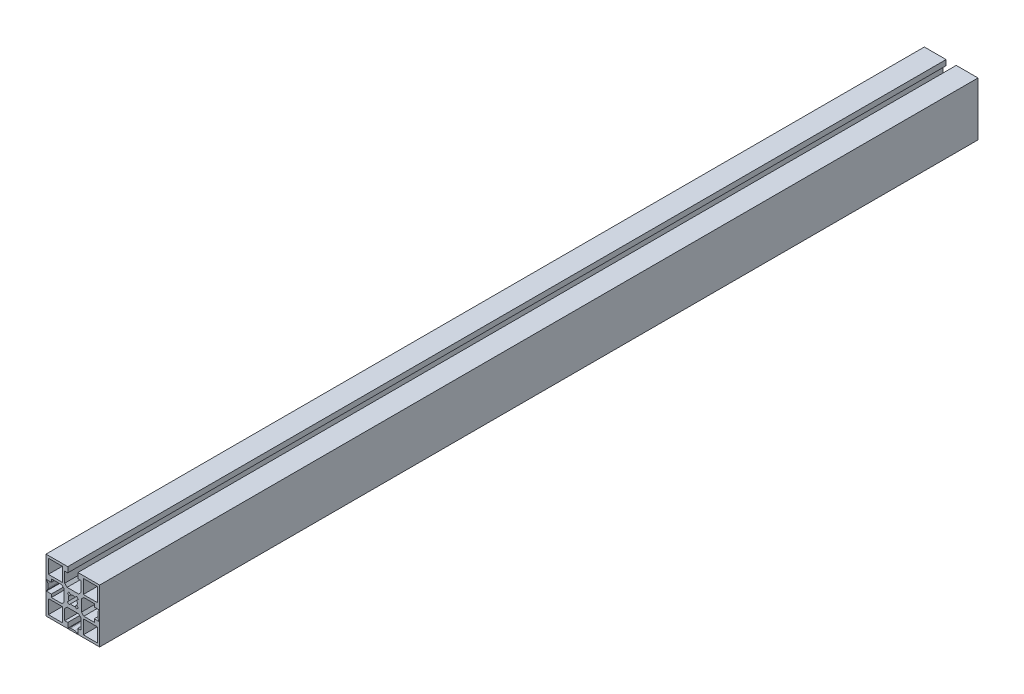
from build123d import *

# Parameters (mm, degrees)
SKETCH1_W           = 11.699975178
SKETCH1_H           = 11.699996949
SKETCH1_W_2         = 11.699990436
SKETCH1_H_2         = 11.699981689
SKETCH1_W_3         = 11.699990437
SKETCH1_H_3         = 11.699975177
SKETCH1_W_4         = 11.699981689
SKETCH1_H_4         = 11.699990436
BOSS_EXTRUDE1_DEPTH = 736.6


with BuildPart() as part:
    # Sketch1 → Boss-Extrude1 (new body)
    with BuildSketch(Plane.XY):
        Polygon((-4.249491247, 17.999291576), (-4.249490956, 22.199304807), (-4.249490956, 22.499297883), (-22.499484399, 22.499298105), (-22.499484948, -22.500701346), (22.500514502, -22.500701895), (22.500515052, 22.499297556), (4.250509108, 22.499297779), (4.250509108, 22.199304487), (4.250508817, 17.999291575), (6.800527063, 17.999291575), (6.800526453, 9.199302988), (4.800526064, 7.199302969), (-4.799479817, 7.199303635), (-6.799479854, 9.199304042), (-6.799479244, 17.999291576), align=None)
        with Locations((-14.649542346, -14.650709384)):
            Rectangle(SKETCH1_W, SKETCH1_H, mode=Mode.SUBTRACT)
        with BuildLine():
            Line((-22.199510799, -4.250714391), (-22.199510799, -3.950696126))
            Line((-22.199510799, -3.950696126), (-21.731790056, -3.48300681))
            ThreePointArc((-21.731790056, -3.48300681), (-21.189814855, -2.671927844), (-20.999497617, -1.71518046))
            Line((-20.999497617, -1.71518046), (-20.999497617, 1.713721031))
            ThreePointArc((-20.999497617, 1.713721031), (-21.189799286, 2.670430863), (-21.731732544, 3.481489907))
            Line((-21.731732544, 3.481489907), (-22.199510888, 3.949267256))
            Line((-22.199510888, 3.949267256), (-22.199510888, 4.249285566))
            Line((-22.199510888, 4.249285566), (-17.999497356, 4.249285704))
            Line((-17.999497356, 4.249285704), (-17.999497356, 6.79927354))
            Line((-17.999497356, 6.79927354), (-9.199509947, 6.799273828))
            Line((-9.199509947, 6.799273828), (-7.199509956, 4.799274012))
            Line((-7.199509956, 4.799274012), (-7.199509641, -4.800732197))
            Line((-7.199509641, -4.800732197), (-9.199509449, -6.800732179))
            Line((-9.199509449, -6.800732179), (-17.99949762, -6.800732468))
            Line((-17.99949762, -6.800732468), (-17.99949762, -4.250714253))
            Line((-17.99949762, -4.250714253), (-22.199510799, -4.250714391))
        make_face(mode=Mode.SUBTRACT)
        with BuildLine():
            Line((-4.24949208, -18.000719999), (-6.799479919, -18.000719999))
            Line((-6.799479919, -18.000719999), (-6.799480207, -9.200732353))
            Line((-6.799480207, -9.200732353), (-4.799480391, -7.200732362))
            Line((-4.799480391, -7.200732362), (4.800525817, -7.200732047))
            Line((4.800525817, -7.200732047), (6.8005258, -9.200731855))
            Line((6.8005258, -9.200731855), (6.800526088, -18.000720263))
            Line((6.800526088, -18.000720263), (4.250507877, -18.000720263))
            Line((4.250507877, -18.000720263), (4.250508015, -22.200733153))
            Line((4.250508015, -22.200733153), (3.950489751, -22.200733153))
            Line((3.950489751, -22.200733153), (3.482800434, -21.73301241))
            ThreePointArc((3.482800434, -21.73301241), (2.671721468, -21.191037209), (1.714974084, -21.000719971))
            Line((1.714974084, -21.000719971), (-1.713927407, -21.000719971))
            ThreePointArc((-1.713927407, -21.000719971), (-2.670637239, -21.19102164), (-3.481696283, -21.732954898))
            Line((-3.481696283, -21.732954898), (-3.949473632, -22.200733242))
            Line((-3.949473632, -22.200733242), (-4.249491942, -22.200733242))
            Line((-4.249491942, -22.200733242), (-4.24949208, -18.000719999))
        make_face(mode=Mode.SUBTRACT)
        with Locations((14.65050626, -14.650767962)):
            Rectangle(SKETCH1_W_2, SKETCH1_H_2, mode=Mode.SUBTRACT)
        with BuildLine():
            Line((-3.181457266, -4.596908447), (-4.595670829, -3.182694885))
            Line((-4.595670829, -3.182694885), (-3.26221457, -1.849238626))
            ThreePointArc((-3.26221457, -1.849238626), (-3.749476751, -0.00071437), (-3.26221457, 1.847809887))
            Line((-3.26221457, 1.847809887), (-4.595670829, 3.181266146))
            Line((-4.595670829, 3.181266146), (-3.181457266, 4.595479708))
            Line((-3.181457266, 4.595479708), (-1.848001007, 3.262023449))
            ThreePointArc((-1.848001007, 3.262023449), (0.000523249, 3.74928563), (1.849047505, 3.262023449))
            Line((1.849047505, 3.262023449), (3.182503764, 4.595479708))
            Line((3.182503764, 4.595479708), (4.596717327, 3.181266146))
            Line((4.596717327, 3.181266146), (3.263261068, 1.847809887))
            ThreePointArc((3.263261068, 1.847809887), (3.750523249, -0.00071437), (3.263261068, -1.849238626))
            Line((3.263261068, -1.849238626), (4.596717327, -3.182694885))
            Line((4.596717327, -3.182694885), (3.182503764, -4.596908447))
            Line((3.182503764, -4.596908447), (1.849047505, -3.263452188))
            ThreePointArc((1.849047505, -3.263452188), (0.000523249, -3.75071437), (-1.848001007, -3.263452188))
            Line((-1.848001007, -3.263452188), (-3.181457266, -4.596908447))
        make_face(mode=Mode.SUBTRACT)
        with Locations((-14.64949028, 14.649335967)):
            Rectangle(SKETCH1_W_3, SKETCH1_H_3, mode=Mode.SUBTRACT)
        with BuildLine():
            Line((9.200519462, -6.800702567), (7.200519471, -4.800702751))
            Line((7.200519471, -4.800702751), (7.200519156, 4.799303458))
            Line((7.200519156, 4.799303458), (9.200518964, 6.79930344))
            Line((9.200518964, 6.79930344), (18.000507424, 6.799303729))
            Line((18.000507424, 6.799303729), (18.000507424, 4.249285514))
            Line((18.000507424, 4.249285514), (22.200520261, 4.249285652))
            Line((22.200520261, 4.249285652), (22.200520261, 3.949267391))
            Line((22.200520261, 3.949267391), (21.732799519, 3.481578075))
            ThreePointArc((21.732799519, 3.481578075), (21.190824318, 2.670499108), (21.000507079, 1.713751724))
            Line((21.000507079, 1.713751724), (21.000507079, -1.715149766))
            ThreePointArc((21.000507079, -1.715149766), (21.190808749, -2.671859599), (21.732742007, -3.482918643))
            Line((21.732742007, -3.482918643), (22.200520351, -3.950695992))
            Line((22.200520351, -3.950695992), (22.200520351, -4.250714302))
            Line((22.200520351, -4.250714302), (18.000507108, -4.25071444))
            Line((18.000507108, -4.25071444), (18.000507108, -6.800702279))
            Line((18.000507108, -6.800702279), (9.200519462, -6.800702567))
        make_face(mode=Mode.SUBTRACT)
        with Locations((14.650561583, 14.6492839)):
            Rectangle(SKETCH1_W_4, SKETCH1_H_4, mode=Mode.SUBTRACT)
    extrude(amount=BOSS_EXTRUDE1_DEPTH)


solid = part.part
